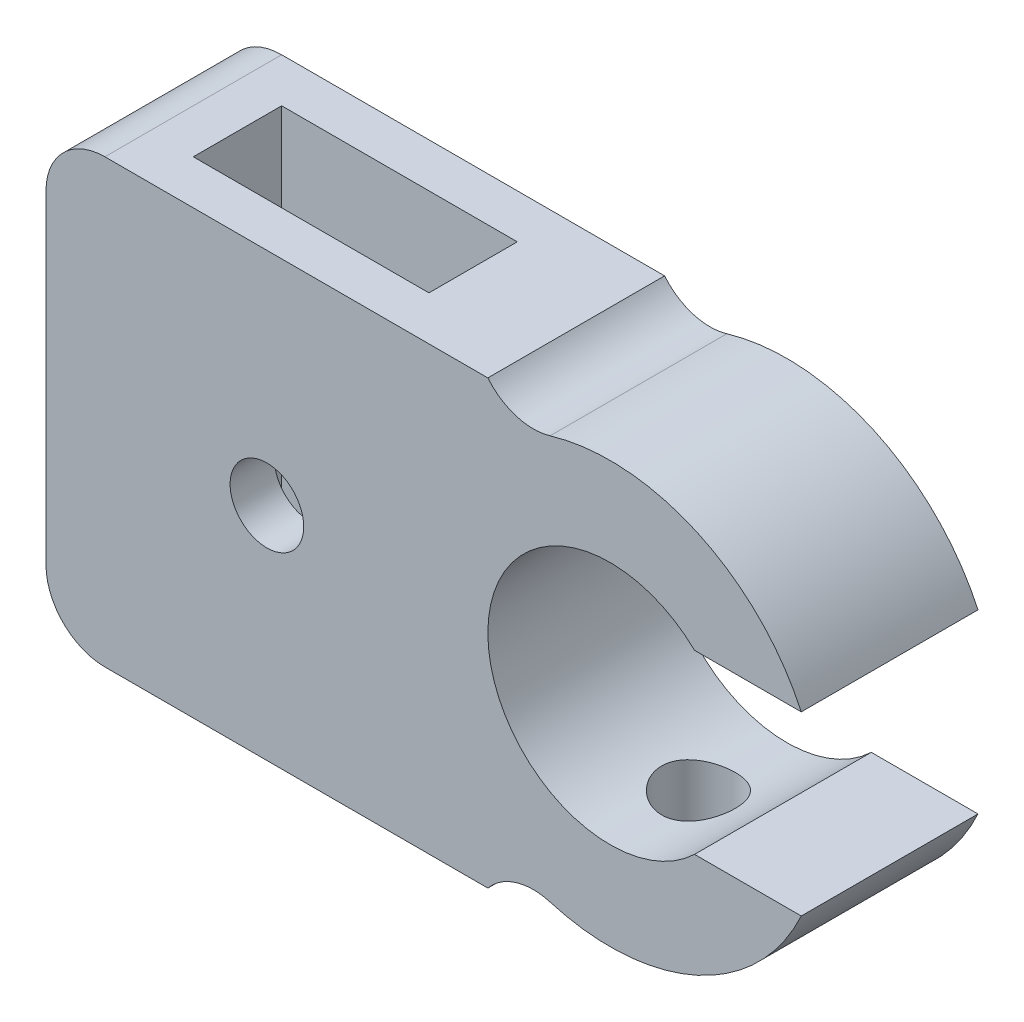
from build123d import *

# Parameters (mm, degrees)
SKETCH1_W                 = 15
SKETCH1_H                 = 15
BOSS_EXTRUDE1_DEPTH       = 3
SKETCH2_W                 = 8
SKETCH2_H                 = 3
CUT_EXTRUDE1_DEPTH        = 18.036725037
BOSS_EXTRUDE2_DEPTH       = 6
FILLET1_R                 = 2
CUT_EXTRUDE2_DEPTH        = 22.111371343
M3X0_5_TAPPED_HOLE1_D     = 2.5
M3X0_5_TAPPED_HOLE1_DEPTH = 7.5
M3X0_5_TAPPED_HOLE1_TIP   = 0.751075774
M3X0_5_TAPPED_HOLE2_D     = 2.5
M3X0_5_TAPPED_HOLE2_DEPTH = 7.5
M3X0_5_TAPPED_HOLE2_TIP   = 0.751075774


with BuildPart() as part:
    # Sketch1 → Boss-Extrude1 (new, symmetric)
    with BuildSketch(Plane.XY):
        Rectangle(SKETCH1_W, SKETCH1_H)
    extrude(amount=BOSS_EXTRUDE1_DEPTH, both=True)

    # Sketch2 → Cut-Extrude1 (cut, through all)
    with BuildSketch(Plane.XZ.offset(7.5)):
        Rectangle(SKETCH2_W, SKETCH2_H)
    extrude(amount=-CUT_EXTRUDE1_DEPTH, mode=Mode.SUBTRACT)

    # Sketch3 → Boss-Extrude2 (add)
    with BuildSketch(Plane.XY.offset(3)):
        with BuildLine():
            Line((7.5, -5.822370651), (7.5, 5.822370651))
            ThreePointArc((7.5, 5.822370651), (18.8, 0), (7.5, -5.822370651))
        make_face()
    extrude(amount=-BOSS_EXTRUDE2_DEPTH)

    # Fillet1
    # the kernel refuses this fillet: 2 mm, written as the material it adds along each edge
    with BuildSketch(Plane(origin=(7.5, -5.822370651, 3), x_dir=(0, -1, 0), z_dir=(0, 0, -1))) as fillet1_piece_1:
        with BuildLine():
            CenterArc((2.948715205, -1.544131065), FILLET1_R, 129.460264065, 67.086296359)
            ThreePointArc((1.031537969, -2.113719903), (0.603278499, -1.014153543), (0, 0))
            Line((0, 0), (1.677629349, 0))
        make_face()
    extrude(amount=6)
    with BuildSketch(Plane(origin=(7.5, 5.822370651, 3), x_dir=(0, 1, 0), z_dir=(0, 0, -1))) as fillet1_piece_2:
        with BuildLine():
            CenterArc((2.948715205, 1.544131065), FILLET1_R, 163.453439576, 67.086296359)
            ThreePointArc((1.031537969, 2.113719903), (0.603278499, 1.014153543), (0, 0))
            Line((0, 0), (1.677629349, 0))
        make_face()
    extrude(amount=6)
    # the kernel refuses this fillet: 2 mm, written as the material it takes off along each edge
    with BuildSketch(Plane(origin=(-7.5, -7.5, 8), x_dir=(1, 0, 0), z_dir=(0, 0, -1)), Plane(origin=(-7.5, 7.5, 8), x_dir=(0, -1, 0), z_dir=(0, 0, -1))) as fillet1_2_piece_1:
        with BuildLine():
            CenterArc((FILLET1_R, -FILLET1_R), FILLET1_R, 90, 90)
            Line((0, -FILLET1_R), (0, 0))
            Line((0, 0), (FILLET1_R, 0))
        make_face()
    extrude(amount=16, mode=Mode.SUBTRACT)

    # Sketch4 → Cut-Extrude2 (cut, through all)
    with BuildSketch(Plane(origin=(0, 0, -3), x_dir=(-1, 0, 0), z_dir=(0, 0, -1))):
        with BuildLine():
            Line((-18.8, 3), (-14.517490192, 3))
            ThreePointArc((-14.517490192, 3), (-7.5, 0), (-14.517490192, -3))
            Line((-14.517490192, -3), (-18.8, -3))
            Line((-18.8, -3), (-18.8, 3))
        make_face()
    extrude(amount=-CUT_EXTRUDE2_DEPTH, mode=Mode.SUBTRACT)

    # M3x0.5 Tapped Hole1
    with Locations(Plane(origin=(0, -7.5, 0), x_dir=(-1, 0, 0), z_dir=(0, -1, 0))):
        with Locations((-11.65, 0)):
            Hole(M3X0_5_TAPPED_HOLE1_D / 2, depth=M3X0_5_TAPPED_HOLE1_DEPTH)
            with Locations((0, 0, -(M3X0_5_TAPPED_HOLE1_DEPTH + M3X0_5_TAPPED_HOLE1_TIP / 2))):  # 118° drill point
                Cone(0, M3X0_5_TAPPED_HOLE1_D / 2, M3X0_5_TAPPED_HOLE1_TIP, mode=Mode.SUBTRACT)

    # M3x0.5 Tapped Hole2
    with Locations(Plane.XY.offset(3)):
        with Locations((0, 0)):
            Hole(M3X0_5_TAPPED_HOLE2_D / 2, depth=M3X0_5_TAPPED_HOLE2_DEPTH)
            with Locations((0, 0, -(M3X0_5_TAPPED_HOLE2_DEPTH + M3X0_5_TAPPED_HOLE2_TIP / 2))):  # 118° drill point
                Cone(0, M3X0_5_TAPPED_HOLE2_D / 2, M3X0_5_TAPPED_HOLE2_TIP, mode=Mode.SUBTRACT)


solid = part.part
